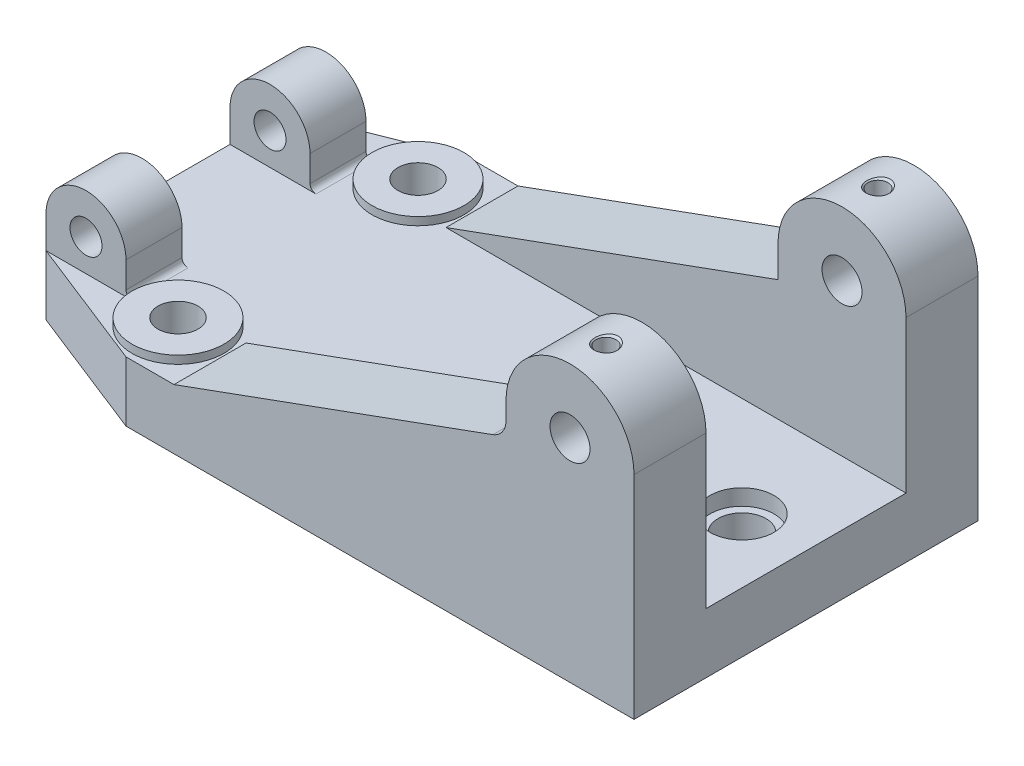
from build123d import *

# Parameters (mm, degrees)
BOSS_EXTRU_1_DEPTH           = 15
BOSS_EXTRU_2_DEPTH           = 18
BOSS_EXTRU_3_DEPTH           = 14
CONG_1_R                     = 5
ENL_V_MAT_EXTRU_1_DEPTH      = 189.917971617
ENL_V_MAT_EXTRU_1_DEPTH_BACK = 189.917971617
ESQUISSE4_R                  = 4
ENL_V_MAT_EXTRU_2_DEPTH      = 195.311605418
ENL_V_MAT_EXTRU_2_DEPTH_BACK = 195.311605418
ESQUISSE5_R                  = 5
ENL_V_MAT_EXTRU_3_DEPTH      = 175.255559452
ENL_V_MAT_EXTRU_3_DEPTH_BACK = 175.255559452
ESQUISSE6_R                  = 5.987648709
ESQUISSE7_R                  = 8
ENL_V_MAT_EXTRU_4_DEPTH      = 4
ENL_V_MAT_EXTRU_5_REACH      = 176.256
ESQUISSE12_R                 = 5
BOSS_EXTRU_4_START           = 2
ESQUISSE13_R                 = 11.5
ESQUISSE13_R_2               = 5
BOSS_EXTRU_4_DEPTH           = 2
CONG_2_R                     = 1.5


# Read off the part's stored shape, not the designer's step: Trou taraudé M61
with BuildPart() as part:
    # Esquisse1 → Boss.-Extru.1 (new body)
    with BuildSketch(Plane(origin=(0, 0, 0), x_dir=(1, 0, 0), z_dir=(0, 1, 0))):
        Polygon((0, -43), (-127, -43), (-160, -30), (-160, 0), (0, 0), align=None)
    boss_extru_1 = extrude(amount=BOSS_EXTRU_1_DEPTH)

    # Esquisse2 → Boss.-Extru.2 (add)
    with BuildSketch(Plane.XY.offset(43)):
        with BuildLine():
            Line((-32, 45.209529444), (-32, 53))
            ThreePointArc((-32, 53), (-16, 69), (0, 53))
            Line((0, 53), (0, 15))
            Line((0, 15), (-115, 15))
            Line((-115, 15), (-32, 45.209529444))
        make_face()
    boss_extru_2 = extrude(amount=-BOSS_EXTRU_2_DEPTH)

    # Esquisse3 → Boss.-Extru.3 (add)
    with BuildSketch(Plane.XY.offset(30)):
        with BuildLine():
            Line((-140, 23), (-140, 15))
            Line((-140, 15), (-160, 15))
            Line((-160, 15), (-160, 23))
            ThreePointArc((-160, 23), (-150, 33), (-140, 23))
        make_face()
    boss_extru_3 = extrude(amount=-BOSS_EXTRU_3_DEPTH)

    # Congé1
    cong_1_edges = [part.edges().sort_by_distance(p)[0] for p in [
        (-32, 45.209529444, 34),
    ]]
    fillet(cong_1_edges, radius=CONG_1_R)

    # Symétrie1: Boss.-Extru.1, Boss.-Extru.2, Boss.-Extru.3 across plane
    add(boss_extru_1.mirror(Plane.XY))
    add(boss_extru_2.mirror(Plane.XY))
    add(boss_extru_3.mirror(Plane.XY))

    # Esquisse4 → Enlèv. mat.-Extru.1 (cut, two sides: drawn at the far end of the back side and taken through both)
    with BuildSketch(Plane.XY.offset(30).offset(-ENL_V_MAT_EXTRU_1_DEPTH_BACK)):
        with Locations(Location((-150, 23, 0), (0, 0, 180))):
            Circle(ESQUISSE4_R)
    extrude(amount=ENL_V_MAT_EXTRU_1_DEPTH + ENL_V_MAT_EXTRU_1_DEPTH_BACK, mode=Mode.SUBTRACT)

    # Esquisse5 → Enlèv. mat.-Extru.2 (cut, two sides: drawn at the far end of the back side and taken through both)
    with BuildSketch(Plane.XY.offset(43).offset(-ENL_V_MAT_EXTRU_2_DEPTH_BACK)):
        with Locations((-16, 53)):
            Circle(ESQUISSE5_R)
    extrude(amount=ENL_V_MAT_EXTRU_2_DEPTH + ENL_V_MAT_EXTRU_2_DEPTH_BACK, mode=Mode.SUBTRACT)

    # Esquisse6 → Enlèv. mat.-Extru.3 (cut, two sides: drawn at the far end of the back side and taken through both)
    with BuildSketch(Plane(origin=(0, 15, 0), x_dir=(1, 0, 0), z_dir=(0, 1, 0)).offset(-ENL_V_MAT_EXTRU_3_DEPTH_BACK)):
        with Locations(Location((-16, 0, 0), (0, 0, 270))):
            Circle(ESQUISSE6_R)
    extrude(amount=ENL_V_MAT_EXTRU_3_DEPTH + ENL_V_MAT_EXTRU_3_DEPTH_BACK, mode=Mode.SUBTRACT)

    # Esquisse7 → Enlèv. mat.-Extru.4 (cut)
    with BuildSketch(Plane(origin=(0, 15, 0), x_dir=(1, 0, 0), z_dir=(0, 1, 0))):
        with Locations(Location((-16, 0, 0), (0, 0, 270))):
            Circle(ESQUISSE7_R)
    extrude(amount=-ENL_V_MAT_EXTRU_4_DEPTH, mode=Mode.SUBTRACT)

    # Trou taraudé M61 outline → Trou taraudé M61 (revolve, cut)
    with BuildSketch(Plane(origin=(-16, 0, 34), x_dir=(1, 0, 0), z_dir=(0, 0, 1))):
        Polygon((0, 57.329808988), (2.5, 57.329808988), (2.5, 68.475), (3.02508907, 69.00008907), (0, 69.00008907), align=None)
    revolve(axis=Axis((-16, 0, 34), (0, 1, 0)), mode=Mode.SUBTRACT)

    # Trou taraud_ M61 2 outline → Trou taraud_ M61 2 (revolve, cut)
    with BuildSketch(Plane(origin=(-16, 0, -34), x_dir=(1, 0, 0), z_dir=(0, 0, 1))):
        Polygon((3.025080927, 69.000080927), (0, 69.000080927), (0, 57.329808988), (2.5, 57.329808988), (2.5, 68.475), align=None)
    revolve(axis=Axis((-16, 0, -34), (0, 1, 0)), mode=Mode.SUBTRACT)

    # Esquisse12 → Enlèv. mat.-Extru.5 (cut, up to next)
    with BuildSketch(Plane(origin=(0, 15, 0), x_dir=(1, 0, 0), z_dir=(0, 1, 0)), mode=Mode.PRIVATE) as enl_v_mat_extru_5_sk1:
        with Locations(Location((-127, -30, 0), (0, 0, 270))):
            Circle(ESQUISSE12_R)
    enl_v_mat_extru_5_tool1 = extrude(enl_v_mat_extru_5_sk1.sketch, amount=-ENL_V_MAT_EXTRU_5_REACH, mode=Mode.PRIVATE) & part.part
    # Esquisse12 → Enlèv. mat.-Extru.5 (cut, up to next)
    with BuildSketch(Plane(origin=(0, 15, 0), x_dir=(1, 0, 0), z_dir=(0, 1, 0)), mode=Mode.PRIVATE) as enl_v_mat_extru_5_sk2:
        with Locations(Location((-127, 30, 0), (0, 0, 270))):
            Circle(ESQUISSE12_R)
    enl_v_mat_extru_5_tool2 = extrude(enl_v_mat_extru_5_sk2.sketch, amount=-ENL_V_MAT_EXTRU_5_REACH, mode=Mode.PRIVATE) & part.part
    add(enl_v_mat_extru_5_tool1.solids().sort_by_distance((-127, 15, 30))[0], mode=Mode.SUBTRACT)
    add(enl_v_mat_extru_5_tool2.solids().sort_by_distance((-127, 15, -30))[0], mode=Mode.SUBTRACT)

    # Esquisse13 → Boss.-Extru.4 (add)
    # profile 1 of 2: a face of its own
    with BuildSketch(Plane(origin=(0, 15, 0), x_dir=(1, 0, 0), z_dir=(0, 1, 0)).offset(BOSS_EXTRU_4_START)):
        with Locations(Location((-127, -30, 0), (0, 0, 90))):
            Circle(ESQUISSE13_R)
        with Locations(Location((-127, -30, 0), (0, 0, 270))):
            Circle(ESQUISSE13_R_2, mode=Mode.SUBTRACT)
    # profile 2 of 2: a face of its own
    with BuildSketch(Plane(origin=(0, 15, 0), x_dir=(1, 0, 0), z_dir=(0, 1, 0)).offset(BOSS_EXTRU_4_START)):
        with Locations(Location((-127, 30, 0), (0, 0, 90))):
            Circle(ESQUISSE13_R)
        with Locations(Location((-127, 30, 0), (0, 0, 270))):
            Circle(ESQUISSE13_R_2, mode=Mode.SUBTRACT)
    extrude(amount=-BOSS_EXTRU_4_DEPTH)

    # Congé2
    cong_2_edges = [part.edges().sort_by_distance(p)[0] for p in [
        (-140, 15, 23),
        (-140, 15, -23),
    ]]
    fillet(cong_2_edges, radius=CONG_2_R - 0.0001)  # a hair under: the kernel refuses the full size


solid = part.part
